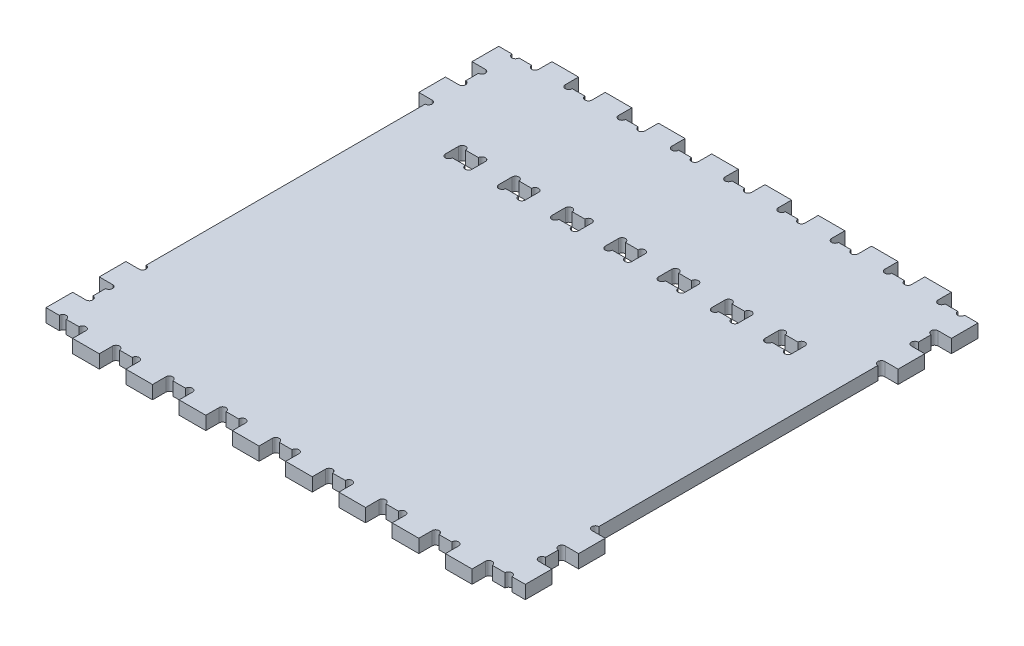
from build123d import *

# Parameters (mm, degrees)
SKETCH1_W               = 457.2
SKETCH1_H               = 457.2
BOSS_EXTRUDE1_DEPTH     = 12.7
CUT_EXTRUDE1_DEPTH      = 12.7
LPATTERN1_COUNT         = 9
LPATTERN1_PITCH         = 50.8
MIRROR1_COPY_1_DEPTH    = 12.7
MIRROR1_COPY_2_DEPTH    = 12.7
MIRROR1_COPY_3_DEPTH    = 12.7
MIRROR1_COPY_4_DEPTH    = 12.7
MIRROR1_COPY_5_DEPTH    = 12.7
MIRROR1_COPY_6_DEPTH    = 12.7
MIRROR1_COPY_7_DEPTH    = 12.7
MIRROR1_COPY_8_DEPTH    = 12.7
MIRROR1_COPY_9_DEPTH    = 12.7
SKETCH3_W               = 12.7
SKETCH3_H               = 12.7
CUT_EXTRUDE2_DEPTH      = 324.538575753
MIRROR3_COPY_1_SKETCH_W = 12.7
MIRROR3_COPY_1_SKETCH_H = 12.7
MIRROR3_COPY_1_DEPTH    = 324.538575753
MIRROR3_COPY_2_SKETCH_W = 12.7
MIRROR3_COPY_2_SKETCH_H = 12.7
MIRROR3_COPY_2_DEPTH    = 324.538575753
CUT_EXTRUDE3_DEPTH      = 324.538575753
LPATTERN2_COUNT         = 9
LPATTERN2_PITCH         = 50.8
MIRROR4_COPY_1_DEPTH    = 324.538575753
MIRROR4_COPY_2_DEPTH    = 324.538575753
MIRROR4_COPY_3_DEPTH    = 324.538575753
MIRROR4_COPY_4_DEPTH    = 324.538575753
MIRROR4_COPY_5_DEPTH    = 324.538575753
MIRROR4_COPY_6_DEPTH    = 324.538575753
MIRROR4_COPY_7_DEPTH    = 324.538575753
MIRROR4_COPY_8_DEPTH    = 324.538575753
MIRROR4_COPY_9_DEPTH    = 324.538575753
CUT_EXTRUDE4_DEPTH      = 324.538575753
LPATTERN3_COUNT         = 7
LPATTERN3_PITCH         = 50.8
SKETCH6_W               = 12.7
SKETCH6_H               = 279.4
CUT_EXTRUDE5_DEPTH      = 324.538575753
SKETCH7_W               = 7.554032718
SKETCH7_H               = 263.786224455
SKETCH7_W_2             = 5.777351388
SKETCH7_H_2             = 261.166116842
BOSS_EXTRUDE2_DEPTH     = 12.7


with BuildPart() as part:
    # Sketch1 → Boss-Extrude1 (new body)
    with BuildSketch(Plane(origin=(0, 0, 0), x_dir=(1, 0, 0), z_dir=(0, 1, 0))):
        Rectangle(SKETCH1_W, SKETCH1_H)
    extrude(amount=BOSS_EXTRUDE1_DEPTH)

    # Sketch2 → Cut-Extrude1 (cut)
    with BuildSketch(Plane(origin=(0, 12.7, 0), x_dir=(1, 0, 0), z_dir=(0, 1, 0))):
        with BuildLine():
            Line((-190.5, 228.6), (-215.9, 228.6))
            Line((-215.9, 228.6), (-215.9, 215.9))
            ThreePointArc((-215.9, 215.9), (-212.598, 212.598), (-209.296, 215.9))
            Line((-209.296, 215.9), (-197.104, 215.9))
            ThreePointArc((-197.104, 215.9), (-193.802, 212.598), (-190.5, 215.9))
            Line((-190.5, 215.9), (-190.5, 228.6))
        make_face()
    cut_extrude1 = extrude(amount=-CUT_EXTRUDE1_DEPTH, mode=Mode.SUBTRACT)

    # LPattern1: Cut-Extrude1 ×9
    with Locations(*[(i * LPATTERN1_PITCH, 0, 0) for i in range(1, LPATTERN1_COUNT)]):
        add(cut_extrude1, mode=Mode.SUBTRACT)

    # Mirror1 copy 1 sketch → Mirror1 copy 1 (cut)
    with BuildSketch(Plane(origin=(50.8, 12.7, 0), x_dir=(1, 0, 0), z_dir=(0, 1, 0))):
        with BuildLine():
            Line((-190.5, -228.6), (-215.9, -228.6))
            Line((-215.9, -228.6), (-215.9, -215.9))
            ThreePointArc((-215.9, -215.9), (-212.598, -212.598), (-209.296, -215.9))
            Line((-209.296, -215.9), (-197.104, -215.9))
            ThreePointArc((-197.104, -215.9), (-193.802, -212.598), (-190.5, -215.9))
            Line((-190.5, -215.9), (-190.5, -228.6))
        make_face()
    extrude(amount=-MIRROR1_COPY_1_DEPTH, mode=Mode.SUBTRACT)

    # Mirror1 copy 2 sketch → Mirror1 copy 2 (cut)
    with BuildSketch(Plane(origin=(101.6, 12.7, 0), x_dir=(1, 0, 0), z_dir=(0, 1, 0))):
        with BuildLine():
            Line((-190.5, -228.6), (-215.9, -228.6))
            Line((-215.9, -228.6), (-215.9, -215.9))
            ThreePointArc((-215.9, -215.9), (-212.598, -212.598), (-209.296, -215.9))
            Line((-209.296, -215.9), (-197.104, -215.9))
            ThreePointArc((-197.104, -215.9), (-193.802, -212.598), (-190.5, -215.9))
            Line((-190.5, -215.9), (-190.5, -228.6))
        make_face()
    extrude(amount=-MIRROR1_COPY_2_DEPTH, mode=Mode.SUBTRACT)

    # Mirror1 copy 3 sketch → Mirror1 copy 3 (cut)
    with BuildSketch(Plane(origin=(152.4, 12.7, 0), x_dir=(1, 0, 0), z_dir=(0, 1, 0))):
        with BuildLine():
            Line((-190.5, -228.6), (-215.9, -228.6))
            Line((-215.9, -228.6), (-215.9, -215.9))
            ThreePointArc((-215.9, -215.9), (-212.598, -212.598), (-209.296, -215.9))
            Line((-209.296, -215.9), (-197.104, -215.9))
            ThreePointArc((-197.104, -215.9), (-193.802, -212.598), (-190.5, -215.9))
            Line((-190.5, -215.9), (-190.5, -228.6))
        make_face()
    extrude(amount=-MIRROR1_COPY_3_DEPTH, mode=Mode.SUBTRACT)

    # Mirror1 copy 4 sketch → Mirror1 copy 4 (cut)
    with BuildSketch(Plane(origin=(203.2, 12.7, 0), x_dir=(1, 0, 0), z_dir=(0, 1, 0))):
        with BuildLine():
            Line((-190.5, -228.6), (-215.9, -228.6))
            Line((-215.9, -228.6), (-215.9, -215.9))
            ThreePointArc((-215.9, -215.9), (-212.598, -212.598), (-209.296, -215.9))
            Line((-209.296, -215.9), (-197.104, -215.9))
            ThreePointArc((-197.104, -215.9), (-193.802, -212.598), (-190.5, -215.9))
            Line((-190.5, -215.9), (-190.5, -228.6))
        make_face()
    extrude(amount=-MIRROR1_COPY_4_DEPTH, mode=Mode.SUBTRACT)

    # Mirror1 copy 5 sketch → Mirror1 copy 5 (cut)
    with BuildSketch(Plane(origin=(254, 12.7, 0), x_dir=(1, 0, 0), z_dir=(0, 1, 0))):
        with BuildLine():
            Line((-190.5, -228.6), (-215.9, -228.6))
            Line((-215.9, -228.6), (-215.9, -215.9))
            ThreePointArc((-215.9, -215.9), (-212.598, -212.598), (-209.296, -215.9))
            Line((-209.296, -215.9), (-197.104, -215.9))
            ThreePointArc((-197.104, -215.9), (-193.802, -212.598), (-190.5, -215.9))
            Line((-190.5, -215.9), (-190.5, -228.6))
        make_face()
    extrude(amount=-MIRROR1_COPY_5_DEPTH, mode=Mode.SUBTRACT)

    # Mirror1 copy 6 sketch → Mirror1 copy 6 (cut)
    with BuildSketch(Plane(origin=(304.8, 12.7, 0), x_dir=(1, 0, 0), z_dir=(0, 1, 0))):
        with BuildLine():
            Line((-190.5, -228.6), (-215.9, -228.6))
            Line((-215.9, -228.6), (-215.9, -215.9))
            ThreePointArc((-215.9, -215.9), (-212.598, -212.598), (-209.296, -215.9))
            Line((-209.296, -215.9), (-197.104, -215.9))
            ThreePointArc((-197.104, -215.9), (-193.802, -212.598), (-190.5, -215.9))
            Line((-190.5, -215.9), (-190.5, -228.6))
        make_face()
    extrude(amount=-MIRROR1_COPY_6_DEPTH, mode=Mode.SUBTRACT)

    # Mirror1 copy 7 sketch → Mirror1 copy 7 (cut)
    with BuildSketch(Plane(origin=(355.6, 12.7, 0), x_dir=(1, 0, 0), z_dir=(0, 1, 0))):
        with BuildLine():
            Line((-190.5, -228.6), (-215.9, -228.6))
            Line((-215.9, -228.6), (-215.9, -215.9))
            ThreePointArc((-215.9, -215.9), (-212.598, -212.598), (-209.296, -215.9))
            Line((-209.296, -215.9), (-197.104, -215.9))
            ThreePointArc((-197.104, -215.9), (-193.802, -212.598), (-190.5, -215.9))
            Line((-190.5, -215.9), (-190.5, -228.6))
        make_face()
    extrude(amount=-MIRROR1_COPY_7_DEPTH, mode=Mode.SUBTRACT)

    # Mirror1 copy 8 sketch → Mirror1 copy 8 (cut)
    with BuildSketch(Plane(origin=(406.4, 12.7, 0), x_dir=(1, 0, 0), z_dir=(0, 1, 0))):
        with BuildLine():
            Line((-190.5, -228.6), (-215.9, -228.6))
            Line((-215.9, -228.6), (-215.9, -215.9))
            ThreePointArc((-215.9, -215.9), (-212.598, -212.598), (-209.296, -215.9))
            Line((-209.296, -215.9), (-197.104, -215.9))
            ThreePointArc((-197.104, -215.9), (-193.802, -212.598), (-190.5, -215.9))
            Line((-190.5, -215.9), (-190.5, -228.6))
        make_face()
    extrude(amount=-MIRROR1_COPY_8_DEPTH, mode=Mode.SUBTRACT)

    # Mirror1 copy 9 sketch → Mirror1 copy 9 (cut)
    with BuildSketch(Plane(origin=(0, 12.7, 0), x_dir=(1, 0, 0), z_dir=(0, 1, 0))):
        with BuildLine():
            Line((-190.5, -228.6), (-215.9, -228.6))
            Line((-215.9, -228.6), (-215.9, -215.9))
            ThreePointArc((-215.9, -215.9), (-212.598, -212.598), (-209.296, -215.9))
            Line((-209.296, -215.9), (-197.104, -215.9))
            ThreePointArc((-197.104, -215.9), (-193.802, -212.598), (-190.5, -215.9))
            Line((-190.5, -215.9), (-190.5, -228.6))
        make_face()
    extrude(amount=-MIRROR1_COPY_9_DEPTH, mode=Mode.SUBTRACT)

    # Sketch3 → Cut-Extrude2 (cut, through all)
    with BuildSketch(Plane(origin=(0, 12.7, 0), x_dir=(1, 0, 0), z_dir=(0, 1, 0))):
        with Locations((-222.25, 222.25)):
            Rectangle(SKETCH3_W, SKETCH3_H)
    cut_extrude2 = extrude(amount=-CUT_EXTRUDE2_DEPTH, mode=Mode.SUBTRACT)

    # Mirror2: Cut-Extrude2 across plane
    add(cut_extrude2.mirror(Plane.ZY), mode=Mode.SUBTRACT)

    # Mirror3 copy 1 sketch → Mirror3 copy 1 (cut, through all)
    with BuildSketch(Plane(origin=(0, 12.7, 0), x_dir=(-1, 0, 0), z_dir=(0, 1, 0))):
        with Locations((-222.25, 222.25)):
            Rectangle(MIRROR3_COPY_1_SKETCH_W, MIRROR3_COPY_1_SKETCH_H)
    extrude(amount=-MIRROR3_COPY_1_DEPTH, mode=Mode.SUBTRACT)

    # Mirror3 copy 2 sketch → Mirror3 copy 2 (cut, through all)
    with BuildSketch(Plane(origin=(0, 12.7, 0), x_dir=(1, 0, 0), z_dir=(0, 1, 0))):
        with Locations((-222.25, -222.25)):
            Rectangle(MIRROR3_COPY_2_SKETCH_W, MIRROR3_COPY_2_SKETCH_H)
    extrude(amount=-MIRROR3_COPY_2_DEPTH, mode=Mode.SUBTRACT)

    # Sketch4 → Cut-Extrude3 (cut, through all)
    with BuildSketch(Plane(origin=(0, 12.7, 0), x_dir=(1, 0, 0), z_dir=(0, 1, 0))):
        with BuildLine():
            Line((-215.9, 190.5), (-228.6, 190.5))
            Line((-228.6, 190.5), (-228.6, 165.1))
            Line((-228.6, 165.1), (-215.9, 165.1))
            ThreePointArc((-215.9, 165.1), (-212.598, 168.402), (-215.9, 171.704))
            Line((-215.9, 171.704), (-215.9, 183.896))
            ThreePointArc((-215.9, 183.896), (-212.598, 187.198), (-215.9, 190.5))
        make_face()
    cut_extrude3 = extrude(amount=-CUT_EXTRUDE3_DEPTH, mode=Mode.SUBTRACT)

    # LPattern2: Cut-Extrude3 ×9
    with Locations(*[(0, 0, i * LPATTERN2_PITCH) for i in range(1, LPATTERN2_COUNT)]):
        add(cut_extrude3, mode=Mode.SUBTRACT)

    # Mirror4 copy 1 sketch → Mirror4 copy 1 (cut, through all)
    with BuildSketch(Plane(origin=(0, 12.7, 50.8), x_dir=(-1, 0, 0), z_dir=(0, 1, 0))):
        with BuildLine():
            Line((-215.9, -190.5), (-228.6, -190.5))
            Line((-228.6, -190.5), (-228.6, -165.1))
            Line((-228.6, -165.1), (-215.9, -165.1))
            ThreePointArc((-215.9, -165.1), (-212.598, -168.402), (-215.9, -171.704))
            Line((-215.9, -171.704), (-215.9, -183.896))
            ThreePointArc((-215.9, -183.896), (-212.598, -187.198), (-215.9, -190.5))
        make_face()
    extrude(amount=-MIRROR4_COPY_1_DEPTH, mode=Mode.SUBTRACT)

    # Mirror4 copy 2 sketch → Mirror4 copy 2 (cut, through all)
    with BuildSketch(Plane(origin=(0, 12.7, 101.6), x_dir=(-1, 0, 0), z_dir=(0, 1, 0))):
        with BuildLine():
            Line((-215.9, -190.5), (-228.6, -190.5))
            Line((-228.6, -190.5), (-228.6, -165.1))
            Line((-228.6, -165.1), (-215.9, -165.1))
            ThreePointArc((-215.9, -165.1), (-212.598, -168.402), (-215.9, -171.704))
            Line((-215.9, -171.704), (-215.9, -183.896))
            ThreePointArc((-215.9, -183.896), (-212.598, -187.198), (-215.9, -190.5))
        make_face()
    extrude(amount=-MIRROR4_COPY_2_DEPTH, mode=Mode.SUBTRACT)

    # Mirror4 copy 3 sketch → Mirror4 copy 3 (cut, through all)
    with BuildSketch(Plane(origin=(0, 12.7, 152.4), x_dir=(-1, 0, 0), z_dir=(0, 1, 0))):
        with BuildLine():
            Line((-215.9, -190.5), (-228.6, -190.5))
            Line((-228.6, -190.5), (-228.6, -165.1))
            Line((-228.6, -165.1), (-215.9, -165.1))
            ThreePointArc((-215.9, -165.1), (-212.598, -168.402), (-215.9, -171.704))
            Line((-215.9, -171.704), (-215.9, -183.896))
            ThreePointArc((-215.9, -183.896), (-212.598, -187.198), (-215.9, -190.5))
        make_face()
    extrude(amount=-MIRROR4_COPY_3_DEPTH, mode=Mode.SUBTRACT)

    # Mirror4 copy 4 sketch → Mirror4 copy 4 (cut, through all)
    with BuildSketch(Plane(origin=(0, 12.7, 203.2), x_dir=(-1, 0, 0), z_dir=(0, 1, 0))):
        with BuildLine():
            Line((-215.9, -190.5), (-228.6, -190.5))
            Line((-228.6, -190.5), (-228.6, -165.1))
            Line((-228.6, -165.1), (-215.9, -165.1))
            ThreePointArc((-215.9, -165.1), (-212.598, -168.402), (-215.9, -171.704))
            Line((-215.9, -171.704), (-215.9, -183.896))
            ThreePointArc((-215.9, -183.896), (-212.598, -187.198), (-215.9, -190.5))
        make_face()
    extrude(amount=-MIRROR4_COPY_4_DEPTH, mode=Mode.SUBTRACT)

    # Mirror4 copy 5 sketch → Mirror4 copy 5 (cut, through all)
    with BuildSketch(Plane(origin=(0, 12.7, 254), x_dir=(-1, 0, 0), z_dir=(0, 1, 0))):
        with BuildLine():
            Line((-215.9, -190.5), (-228.6, -190.5))
            Line((-228.6, -190.5), (-228.6, -165.1))
            Line((-228.6, -165.1), (-215.9, -165.1))
            ThreePointArc((-215.9, -165.1), (-212.598, -168.402), (-215.9, -171.704))
            Line((-215.9, -171.704), (-215.9, -183.896))
            ThreePointArc((-215.9, -183.896), (-212.598, -187.198), (-215.9, -190.5))
        make_face()
    extrude(amount=-MIRROR4_COPY_5_DEPTH, mode=Mode.SUBTRACT)

    # Mirror4 copy 6 sketch → Mirror4 copy 6 (cut, through all)
    with BuildSketch(Plane(origin=(0, 12.7, 304.8), x_dir=(-1, 0, 0), z_dir=(0, 1, 0))):
        with BuildLine():
            Line((-215.9, -190.5), (-228.6, -190.5))
            Line((-228.6, -190.5), (-228.6, -165.1))
            Line((-228.6, -165.1), (-215.9, -165.1))
            ThreePointArc((-215.9, -165.1), (-212.598, -168.402), (-215.9, -171.704))
            Line((-215.9, -171.704), (-215.9, -183.896))
            ThreePointArc((-215.9, -183.896), (-212.598, -187.198), (-215.9, -190.5))
        make_face()
    extrude(amount=-MIRROR4_COPY_6_DEPTH, mode=Mode.SUBTRACT)

    # Mirror4 copy 7 sketch → Mirror4 copy 7 (cut, through all)
    with BuildSketch(Plane(origin=(0, 12.7, 355.6), x_dir=(-1, 0, 0), z_dir=(0, 1, 0))):
        with BuildLine():
            Line((-215.9, -190.5), (-228.6, -190.5))
            Line((-228.6, -190.5), (-228.6, -165.1))
            Line((-228.6, -165.1), (-215.9, -165.1))
            ThreePointArc((-215.9, -165.1), (-212.598, -168.402), (-215.9, -171.704))
            Line((-215.9, -171.704), (-215.9, -183.896))
            ThreePointArc((-215.9, -183.896), (-212.598, -187.198), (-215.9, -190.5))
        make_face()
    extrude(amount=-MIRROR4_COPY_7_DEPTH, mode=Mode.SUBTRACT)

    # Mirror4 copy 8 sketch → Mirror4 copy 8 (cut, through all)
    with BuildSketch(Plane(origin=(0, 12.7, 406.4), x_dir=(-1, 0, 0), z_dir=(0, 1, 0))):
        with BuildLine():
            Line((-215.9, -190.5), (-228.6, -190.5))
            Line((-228.6, -190.5), (-228.6, -165.1))
            Line((-228.6, -165.1), (-215.9, -165.1))
            ThreePointArc((-215.9, -165.1), (-212.598, -168.402), (-215.9, -171.704))
            Line((-215.9, -171.704), (-215.9, -183.896))
            ThreePointArc((-215.9, -183.896), (-212.598, -187.198), (-215.9, -190.5))
        make_face()
    extrude(amount=-MIRROR4_COPY_8_DEPTH, mode=Mode.SUBTRACT)

    # Mirror4 copy 9 sketch → Mirror4 copy 9 (cut, through all)
    with BuildSketch(Plane(origin=(0, 12.7, 0), x_dir=(-1, 0, 0), z_dir=(0, 1, 0))):
        with BuildLine():
            Line((-215.9, -190.5), (-228.6, -190.5))
            Line((-228.6, -190.5), (-228.6, -165.1))
            Line((-228.6, -165.1), (-215.9, -165.1))
            ThreePointArc((-215.9, -165.1), (-212.598, -168.402), (-215.9, -171.704))
            Line((-215.9, -171.704), (-215.9, -183.896))
            ThreePointArc((-215.9, -183.896), (-212.598, -187.198), (-215.9, -190.5))
        make_face()
    extrude(amount=-MIRROR4_COPY_9_DEPTH, mode=Mode.SUBTRACT)

    # Sketch5 → Cut-Extrude4 (cut, through all)
    with BuildSketch(Plane(origin=(0, 12.7, 0), x_dir=(1, 0, 0), z_dir=(0, 1, 0))):
        with BuildLine():
            Line((-158.496, 114.3), (-146.304, 114.3))
            ThreePointArc((-146.304, 114.3), (-143.002, 117.602), (-139.7, 114.3))
            Line((-139.7, 114.3), (-139.7, 101.6))
            ThreePointArc((-139.7, 101.6), (-143.002, 98.298), (-146.304, 101.6))
            Line((-146.304, 101.6), (-158.496, 101.6))
            ThreePointArc((-158.496, 101.6), (-161.798, 98.298), (-165.1, 101.6))
            Line((-165.1, 101.6), (-165.1, 114.3))
            ThreePointArc((-165.1, 114.3), (-161.798, 117.602), (-158.496, 114.3))
        make_face()
    cut_extrude4 = extrude(amount=-CUT_EXTRUDE4_DEPTH, mode=Mode.SUBTRACT)

    # LPattern3: Cut-Extrude4 ×7
    with Locations(*[(i * LPATTERN3_PITCH, 0, 0) for i in range(1, LPATTERN3_COUNT)]):
        add(cut_extrude4, mode=Mode.SUBTRACT)

    # Sketch6 → Cut-Extrude5 (cut, through all)
    with BuildSketch(Plane(origin=(0, 12.7, 0), x_dir=(1, 0, 0), z_dir=(0, 1, 0))):
        with Locations((-222.25, 0)):
            Rectangle(SKETCH6_W, SKETCH6_H)
        with Locations((222.25, 0)):
            Rectangle(SKETCH6_W, SKETCH6_H)
    extrude(amount=-CUT_EXTRUDE5_DEPTH, mode=Mode.SUBTRACT)

    # Sketch7 → Boss-Extrude2 (add)
    with BuildSketch(Plane(origin=(0, 12.7, 0), x_dir=(1, 0, 0), z_dir=(0, 1, 0))):
        with Locations((-212.122983641, 1.202887772)):
            Rectangle(SKETCH7_W, SKETCH7_H)
        with Locations((213.011324306, 2.512941579)):
            Rectangle(SKETCH7_W_2, SKETCH7_H_2)
    extrude(amount=-BOSS_EXTRUDE2_DEPTH)


solid = part.part
